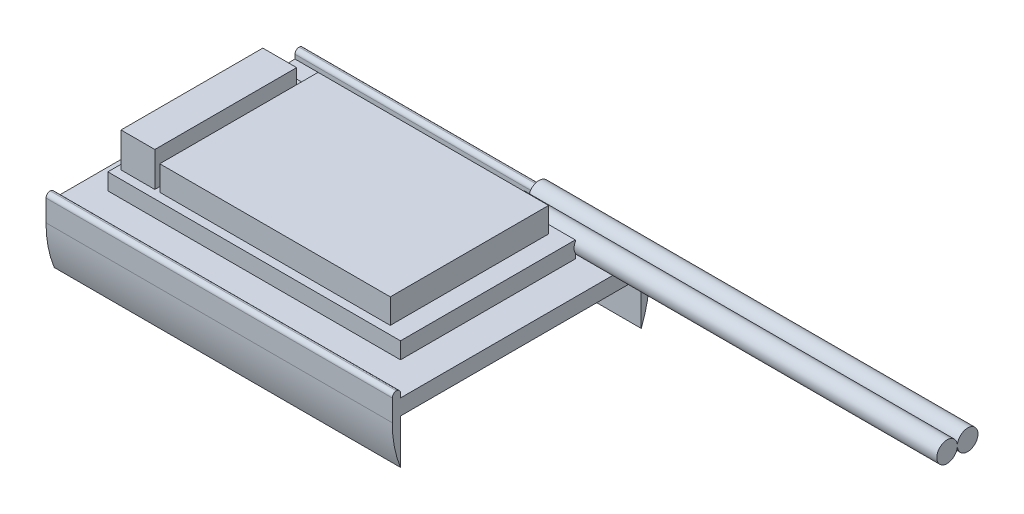
from build123d import *

# Parameters (mm, degrees)
SKETCH1_W               = 21
SKETCH1_H               = 15.6
BOSS_EXTRUDE1_DEPTH     = 0.95
SKETCH2_W               = 21
SKETCH2_H               = 0.5
BOSS_EXTRUDE2_DEPTH     = 2.7
FILLET1_R               = 7
SKETCH3_W               = 17.75
SKETCH3_H               = 10.6
BOSS_EXTRUDE3_DEPTH     = 1
SKETCH4_W               = 13.98
SKETCH4_H               = 9.6
BOSS_EXTRUDE4_DEPTH     = 2.5
SKETCH5_W               = 2.05
SKETCH5_H               = 8.6
BOSS_EXTRUDE5_DEPTH     = 3.1
SKETCH6_W               = 21
SKETCH6_H               = 0.5
BOSS_EXTRUDE6_DEPTH     = 0.5
FILLET2_R               = 0.25
BOSS_EXTRUDE9_START     = -7.66445529
BOSS_EXTRUDE9_OUTLINE_W = 26
BOSS_EXTRUDE9_OUTLINE_H = 0.1
BOSS_EXTRUDE9_DEPTH     = 2.36445529
BOSS_EXTRUDE9_START_2   = 4.5
BOSS_EXTRUDE9_2_DEPTH   = 26
SKETCH8_R               = 0.25
BOSS_EXTRUDE10_DEPTH    = 0.5


with BuildPart() as part:
    # Sketch1 → Boss-Extrude1 (new body)
    with BuildSketch(Plane(origin=(0, 0, 0), x_dir=(1, 0, 0), z_dir=(0, 1, 0))):
        Rectangle(SKETCH1_W, SKETCH1_H)
    extrude(amount=-BOSS_EXTRUDE1_DEPTH)

    # Sketch2 → Boss-Extrude2 (add)
    with BuildSketch(Plane.XZ.offset(0.95)):
        with Locations((0, 7.55)):
            Rectangle(SKETCH2_W, SKETCH2_H)
        with Locations((0, -7.55)):
            Rectangle(SKETCH2_W, SKETCH2_H)
    extrude(amount=BOSS_EXTRUDE2_DEPTH)

    # Fillet1
    # the kernel refuses this fillet: 7 mm, written as the material it takes off along each edge
    with BuildSketch(Plane(origin=(-16.995190528, -3.65, -7.8), x_dir=(0, 1, 0), z_dir=(1, 0, 0))) as fillet1_piece_1:
        with BuildLine():
            CenterArc((2.598076211, 7), FILLET1_R, 248.213210702, 21.786789298)
            Line((0, 0.5), (0, 0))
            Line((0, 0), (2.598076211, 0))
        make_face()
    extrude(amount=33.990381057, mode=Mode.SUBTRACT)
    with BuildSketch(Plane(origin=(-16.995190528, -3.65, 7.8), x_dir=(0, 1, 0), z_dir=(1, 0, 0))) as fillet1_piece_2:
        with BuildLine():
            CenterArc((2.598076211, -7), FILLET1_R, 90, 21.786789298)
            Line((0, -0.5), (0, 0))
            Line((0, 0), (2.598076211, 0))
        make_face()
    extrude(amount=33.990381057, mode=Mode.SUBTRACT)

    # Sketch3 → Boss-Extrude3 (add)
    with BuildSketch(Plane(origin=(0, 0, 0), x_dir=(1, 0, 0), z_dir=(0, 1, 0))):
        with Locations((-0.375, 0)):
            Rectangle(SKETCH3_W, SKETCH3_H)
    extrude(amount=BOSS_EXTRUDE3_DEPTH)

    # Sketch4 → Boss-Extrude4 (add)
    with BuildSketch(Plane(origin=(0, 0, 0), x_dir=(1, 0, 0), z_dir=(0, 1, 0))):
        with Locations((0.39, 0)):
            Rectangle(SKETCH4_W, SKETCH4_H)
    extrude(amount=BOSS_EXTRUDE4_DEPTH)

    # Sketch5 → Boss-Extrude5 (add)
    with BuildSketch(Plane(origin=(0, 0, 0), x_dir=(1, 0, 0), z_dir=(0, 1, 0))):
        with Locations((-7.925, -0.5)):
            Rectangle(SKETCH5_W, SKETCH5_H)
    extrude(amount=BOSS_EXTRUDE5_DEPTH)

    # Sketch6 → Boss-Extrude6 (add)
    with BuildSketch(Plane(origin=(0, 0, 0), x_dir=(1, 0, 0), z_dir=(0, 1, 0))):
        with Locations((0, 7.55)):
            Rectangle(SKETCH6_W, SKETCH6_H)
        with Locations((0, -7.55)):
            Rectangle(SKETCH6_W, SKETCH6_H)
    extrude(amount=BOSS_EXTRUDE6_DEPTH)

    # Fillet2
    fillet2_edges = [part.edges().sort_by_distance(p)[0] for p in [
        (0, 0.5, 7.8),
        (0, 0.5, 7.3),
        (0, 0.5, -7.3),
        (0, 0.5, -7.8),
    ]]
    fillet(fillet2_edges, radius=FILLET2_R - 0.0001)  # a hair under: the kernel refuses the full size

    # Boss-Extrude9: read off the stored shape, not the designer's step
    # Boss-Extrude9 outline → Boss-Extrude9 (add)
    with BuildSketch(Plane.XY.offset(BOSS_EXTRUDE9_START)):
        with Locations((17.5, 0.64)):
            Rectangle(BOSS_EXTRUDE9_OUTLINE_W, BOSS_EXTRUDE9_OUTLINE_H)
    extrude(amount=BOSS_EXTRUDE9_DEPTH)

    # Boss-Extrude9 2 outline → Boss-Extrude9 2 (add)
    with BuildSketch(Plane.YZ.offset(BOSS_EXTRUDE9_START_2)):
        with BuildLine():
            Line((0.69, -5.3), (0.69, -6.468486055))
            ThreePointArc((0.69, -6.468486055), (0.559870848, -5.22628961), (0.59, -6.474919995))
            Line((0.59, -6.474919995), (0.59, -5.3))
            Line((0.59, -5.3), (0.69, -5.3))
        make_face()
        with BuildLine():
            Line((0.69, -6.481513945), (0.69, -7.66445529))
            Line((0.69, -7.66445529), (0.59, -7.66445529))
            Line((0.59, -7.66445529), (0.59, -6.475080005))
            ThreePointArc((0.59, -6.475080005), (0.559870848, -7.72371039), (0.69, -6.481513945))
        make_face()
    extrude(amount=BOSS_EXTRUDE9_2_DEPTH)

    # Sketch8 → Boss-Extrude10 (add)
    with BuildSketch(Plane.ZY.offset(10.5)):
        with Locations((0, -0.485546963)):
            Circle(SKETCH8_R)
    extrude(amount=BOSS_EXTRUDE10_DEPTH)


solid = part.part
